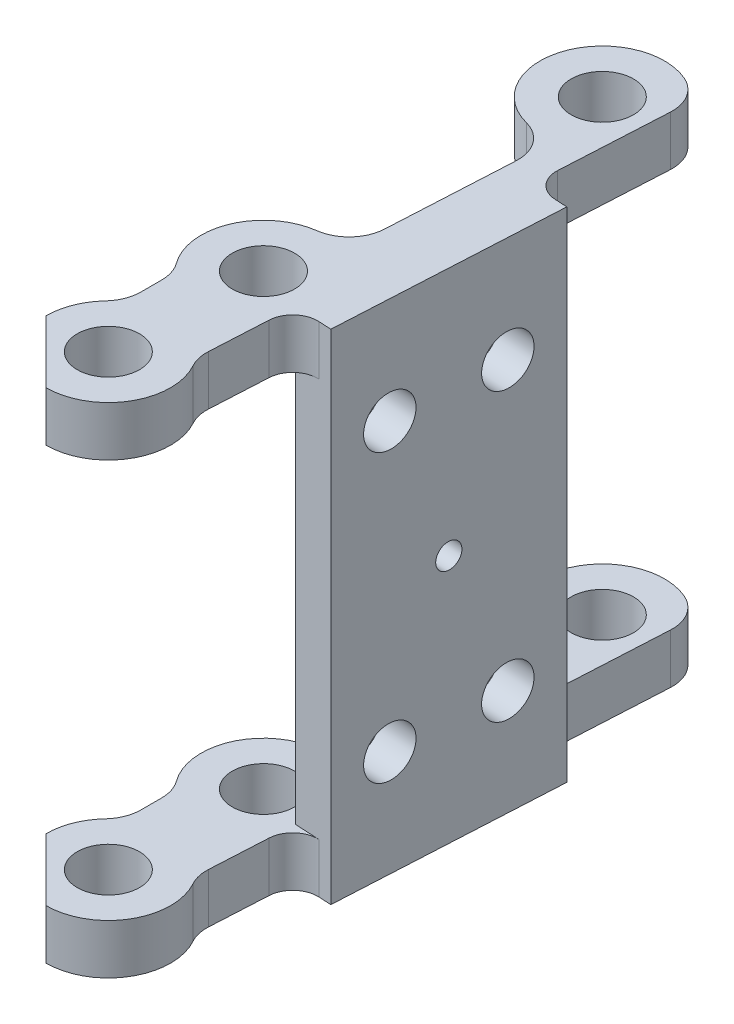
from build123d import *

# Parameters (mm, degrees)
SKETCH2_R           = 2.5
BOSS_EXTRUDE3_DEPTH = 4
BOSS_EXTRUDE4_DEPTH = 40
FILLET1_R           = 2
SKETCH4_R           = 2
SKETCH4_R_2         = 1
CUT_EXTRUDE1_DEPTH  = 10
FILLET3_R           = 3
FILLET4_R           = 3
SKETCH5_R           = 1.5
BOSS_EXTRUDE5_DEPTH = 2.5


with BuildPart() as part:
    # Sketch2 → Boss-Extrude3 (new body)
    with BuildSketch(Plane(origin=(0, 0, 0), x_dir=(1, 0, 0), z_dir=(0, 1, 0))):
        with BuildLine():
            ThreePointArc((83.62627208, 73.409646321), (82.043328915, 71.619198109), (81.472187529, 69.298592288))
            Line((81.472187529, 69.298592288), (86.472187529, 64.298592288))
            ThreePointArc((86.472187529, 64.298592288), (90.961711336, 67.097643404), (90.424672494, 72.360921892))
            Line((90.424672494, 72.360921892), (90.926689774, 81.686644374))
            Line((90.926689774, 81.686644374), (92.048119667, 102.518883374))
            Line((92.048119667, 102.518883374), (92.450855554, 110.000305351))
            ThreePointArc((92.450855554, 110.000305351), (83.843337657, 108.444197301), (89.726552777, 101.971283238))
            Line((89.726552777, 101.971283238), (88.863578179, 85.80252536))
            ThreePointArc((88.863578179, 85.80252536), (82.866493913, 83.799788509), (83.62627208, 77.522949199))
            Line((83.62627208, 77.522949199), (83.62627208, 73.409646321))
        make_face()
        with Locations((86.472187529, 69.298592288)):
            Circle(SKETCH2_R, mode=Mode.SUBTRACT)
        with Locations((87.092070964, 81.126869023)):
            Circle(SKETCH2_R, mode=Mode.SUBTRACT)
        with Locations((88.578200606, 106.837625529)):
            Circle(SKETCH2_R, mode=Mode.SUBTRACT)
    boss_extrude3 = extrude(amount=BOSS_EXTRUDE3_DEPTH)

    # Sketch3 → Boss-Extrude4 (add)
    with BuildSketch(Plane(origin=(0, 4, 0), x_dir=(1, 0, 0), z_dir=(0, 1, 0))):
        Polygon((91.800965367, 97.92762227), (90.833399946, 79.953646162), (93.833399946, 79.792151774), (94.800965367, 97.766127883), align=None)
    extrude(amount=-BOSS_EXTRUDE4_DEPTH)

    # Mirror1: Boss-Extrude3 across plane
    add(boss_extrude3.mirror(Plane.ZX.offset(-16)))

    # Fillet1
    fillet1_edges = [part.edges().sort_by_distance(p)[0] for p in [
        (90.833399946, -34, -79.953646162),
        (90.833399946, 2, -79.953646162),
        (91.800965367, -34, -97.92762227),
        (91.800965367, 2, -97.92762227),
    ]]
    fillet(fillet1_edges, radius=FILLET1_R)

    # Sketch4 → Cut-Extrude1 (cut)
    with BuildSketch(Plane(origin=(86.279355648, 0, 4.6445439), x_dir=(-0.05375363451621944, 0, 0.9985542282601866), z_dir=(-0.9985542282601865, 0, -0.05375363451621943))):
        with Locations((-89.220676822, -4.5)):
            Circle(SKETCH4_R)
        with Locations((-98.220676822, -4.5)):
            Circle(SKETCH4_R)
        with Locations((-89.220676822, -27.5)):
            Circle(SKETCH4_R)
        with Locations((-98.220676822, -27.5)):
            Circle(SKETCH4_R)
        with Locations((-93.720676822, -16)):
            Circle(SKETCH4_R_2)
    extrude(amount=-CUT_EXTRUDE1_DEPTH, mode=Mode.SUBTRACT)

    # Fillet3
    fillet3_edges = [part.edges().sort_by_distance(p)[0] for p in [
        (92.450855554, -34, -110.000305351),
        (92.450855554, 2, -110.000305351),
        (90.424672494, -34, -72.360921892),
        (90.424672494, 2, -72.360921892),
        (89.726552777, -34, -101.971283238),
        (89.726552777, 2, -101.971283238),
        (83.62627208, 2, -73.409646321),
        (83.62627208, 2, -77.522949199),
        (83.62627208, -34, -73.409646321),
        (83.62627208, -34, -77.522949199),
    ]]
    fillet(fillet3_edges, radius=FILLET3_R)

    # Fillet4
    fillet4_edges = [part.edges().sort_by_distance(p)[0] for p in [
        (88.863578179, -34, -85.80252536),
        (88.863578179, 2, -85.80252536),
    ]]
    fillet(fillet4_edges, radius=FILLET4_R)

    # Sketch5 → Boss-Extrude5 (add, symmetric)
    with BuildSketch(Plane(origin=(5.091580643, 0, -94.583732344), x_dir=(0.9985542282601866, 0, 0.05375363451622039), z_dir=(-0.05375363451622039, 0, 0.9985542282601866))):
        with BuildLine():
            Line((86.404276509, -6.817365582), (86.404276509, -16.023444458))
            add(Edge.make_bspline(
                [(84.550060655, -13.142148877), (85.102197456, -13.260435881), (85.690337985, -14.287869789), (86.286678462, -15.365360216), (86.404276509, -16.023444458)],
                knots=[0, 0, 0, 0, 0.420965898, 1, 1, 1, 1], degree=3))
            ThreePointArc((84.550060655, -13.142148877), (82.550060655, -11.142148877), (84.550060655, -9.142148877))
            add(Edge.make_bspline(
                [(84.550060655, -9.142148877), (85.37626062, -8.996556919), (85.596423211, -8.452289004), (86.029941093, -7.537427622), (86.34002969, -7.176340806), (86.404276509, -6.817365582)],
                knots=[0, 0, 0, 0, 0.605222423, 0.705222423, 1, 1, 1, 1], degree=3))
        make_face()
        with Locations((84.550060655, -11.142148877)):
            Circle(SKETCH5_R, mode=Mode.SUBTRACT)
    extrude(amount=BOSS_EXTRUDE5_DEPTH, both=True)


solid = part.part
